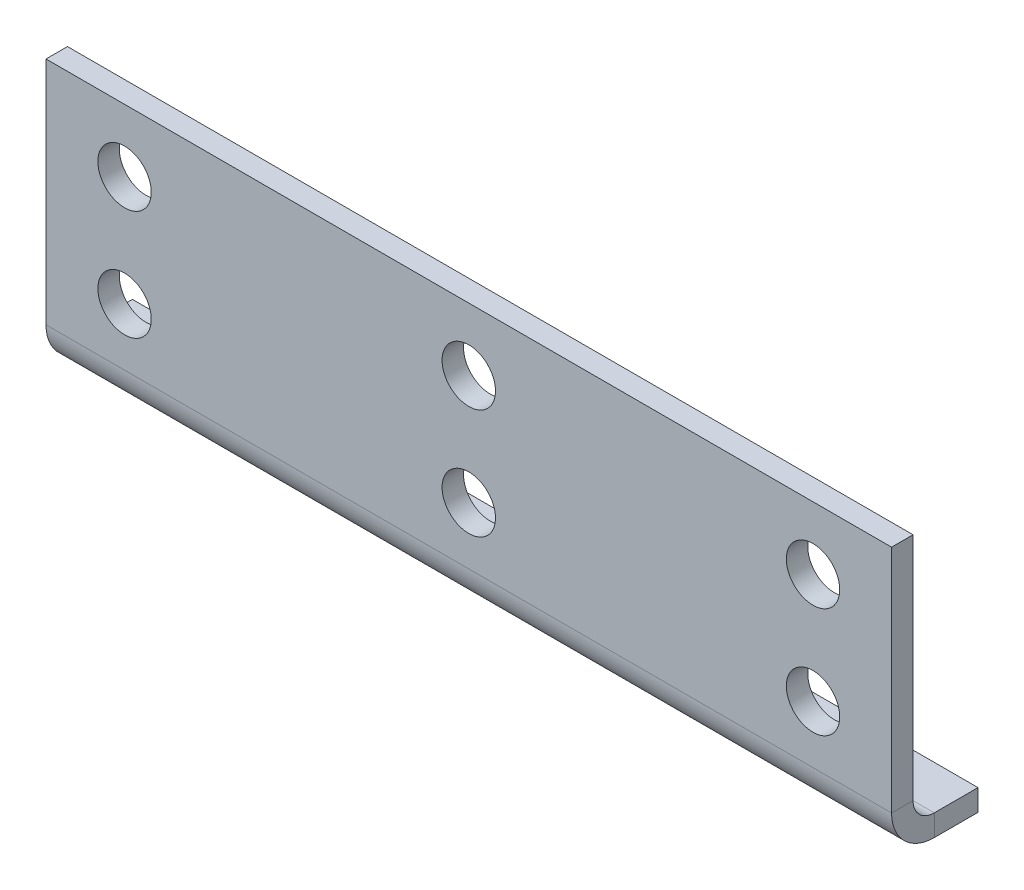
from build123d import *

# Parameters (mm, degrees)
SKETCH1_W                    = 53.808
SKETCH1_H                    = 16
BOSS_EXTRUDE1_DEPTH          = 1.4986
CONVERT_SOLID1_OUTLINE_W     = 53.808
CONVERT_SOLID1_OUTLINE_H     = 16
CONVERT_SOLID1_DEPTH         = 0.1316
EDGE_FLANGE1_STRIP_W         = 8.168
EDGE_FLANGE1_STRIP_H         = 1.367
EDGE_FLANGE1_STRIP_CUT_DEPTH = 53.808
EDGE_FLANGE1_DEPTH           = 53.808
M3_CLEARANCE_HOLE1_D         = 3.4


# Read off the part's stored shape, not the designer's step: Convert-Solid1
# Sheet-metal steps are written as plain solids
with BuildPart() as part:
    # Sketch1 → Boss-Extrude1 (new body)
    with BuildSketch(Plane.XY):
        with Locations((-41.271079995, -85.427168175)):
            Rectangle(SKETCH1_W, SKETCH1_H)
    extrude(amount=BOSS_EXTRUDE1_DEPTH)

    # Convert-Solid1 outline → Convert-Solid1 (cut)
    with BuildSketch(Plane.XY):
        with Locations((-41.271079995, -85.427168175)):
            Rectangle(CONVERT_SOLID1_OUTLINE_W, CONVERT_SOLID1_OUTLINE_H)
    extrude(amount=CONVERT_SOLID1_DEPTH, mode=Mode.SUBTRACT)

    # Edge-Flange1 strip (across the edge) → Edge-Flange1 strip cut (cut)
    with BuildSketch(Plane(origin=(-14.367079995, -93.427168175, 0.1316), x_dir=(0, 1, 0), z_dir=(-1, 0, 0))):
        with Locations((-2.734, -0.6835)):
            Rectangle(EDGE_FLANGE1_STRIP_W, EDGE_FLANGE1_STRIP_H)
    extrude(amount=EDGE_FLANGE1_STRIP_CUT_DEPTH, mode=Mode.SUBTRACT)

    # Edge-Flange1 section (across the edge) → Edge-Flange1 (add)
    with BuildSketch(Plane(origin=(-14.367079995, -93.427168175, 0.1316), x_dir=(0, 1, 0), z_dir=(-1, 0, 0))):
        with BuildLine():
            Line((-1.367, 1.35), (-1.367, 4.133))
            Line((-1.367, 4.133), (0, 4.133))
            Line((0, 4.133), (0, 1.35))
            ThreePointArc((0, 1.35), (0.395405845, 0.395405845), (1.35, 0))
            Line((1.35, 0), (1.35, -1.367))
            ThreePointArc((1.35, -1.367), (-0.571209124, -0.571209124), (-1.367, 1.35))
        make_face()
    extrude(amount=EDGE_FLANGE1_DEPTH)

    # M3 Clearance Hole1 (through all)
    with Locations(Plane(origin=(0, 0, 0.1316), x_dir=(-1, 0, 0), z_dir=(0, 0, -1))):
        with Locations((19.367079995, -81.427168175), (19.367079995, -88.427168175), (63.175079995, -88.427168175), (63.175079995, -81.427168175), (41.271079995, -88.427168175), (41.271079995, -81.427168175)):
            Hole(M3_CLEARANCE_HOLE1_D / 2)


solid = part.part
